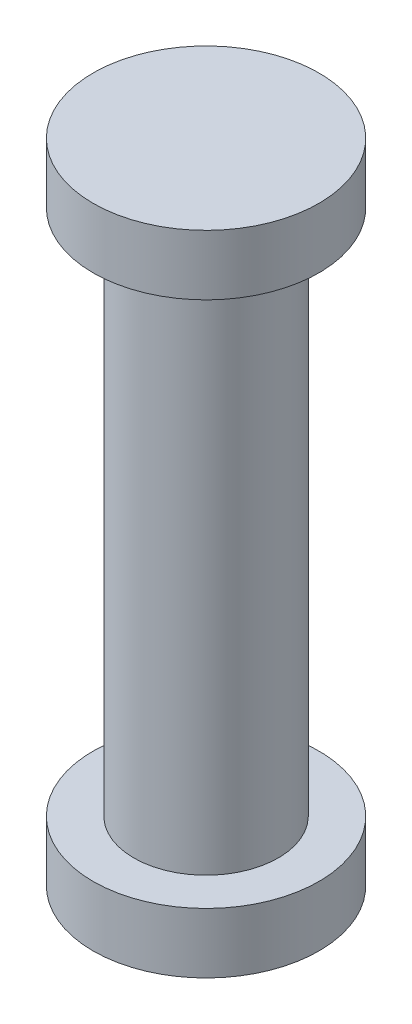
from build123d import *

# Parameters (mm, degrees)
SKETCH1_R           = 3.048
BOSS_EXTRUDE1_DEPTH = 11.1125
SKETCH2_R           = 4.7625
BOSS_EXTRUDE2_DEPTH = 2.54


with BuildPart() as part:
    # Sketch1 → Boss-Extrude1 (new, symmetric)
    with BuildSketch(Plane(origin=(0, 0, 0), x_dir=(1, 0, 0), z_dir=(0, 1, 0))):
        Circle(SKETCH1_R)
    extrude(amount=BOSS_EXTRUDE1_DEPTH, both=True)

    # Sketch2 → Boss-Extrude2 (add)
    with BuildSketch(Plane(origin=(0, 11.1125, 0), x_dir=(1, 0, 0), z_dir=(0, 1, 0))):
        Circle(SKETCH2_R)
    boss_extrude2 = extrude(amount=BOSS_EXTRUDE2_DEPTH)

    # Mirror1: Boss-Extrude2 across plane
    add(boss_extrude2.mirror(Plane.ZX))


solid = part.part
